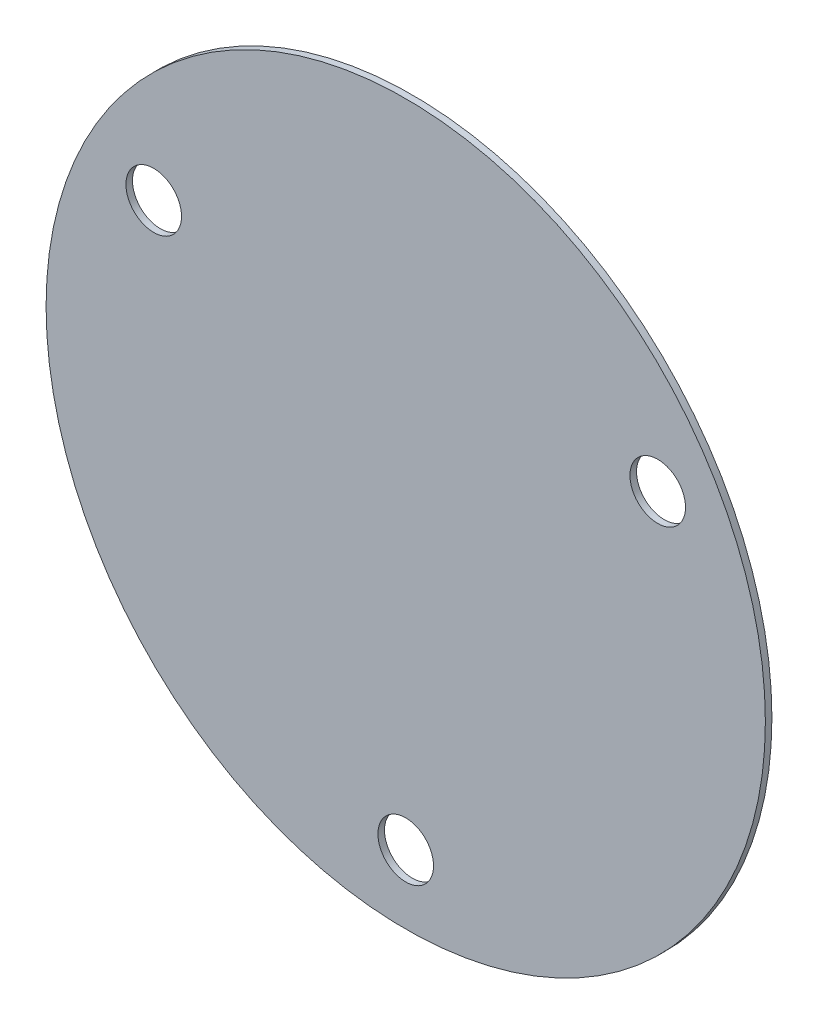
from build123d import *

# Parameters (mm, degrees)
SKETCH_1_R             = 110
SKETCH_1_R_2           = 8.5
SM_BASE_FLANGE_1_DEPTH = 2


# Sheet-metal steps are written as plain solids
with BuildPart() as part:
    # Sketch 1 → Базовая кромка1 (new body)
    with BuildSketch(Plane.XY):
        Circle(SKETCH_1_R)
        with Locations((77.076260937, 44.5)):
            Circle(SKETCH_1_R_2, mode=Mode.SUBTRACT)
        with Locations((0, -89)):
            Circle(SKETCH_1_R_2, mode=Mode.SUBTRACT)
        with Locations((-77.076260937, 44.5)):
            Circle(SKETCH_1_R_2, mode=Mode.SUBTRACT)
    extrude(amount=-SM_BASE_FLANGE_1_DEPTH)


solid = part.part
